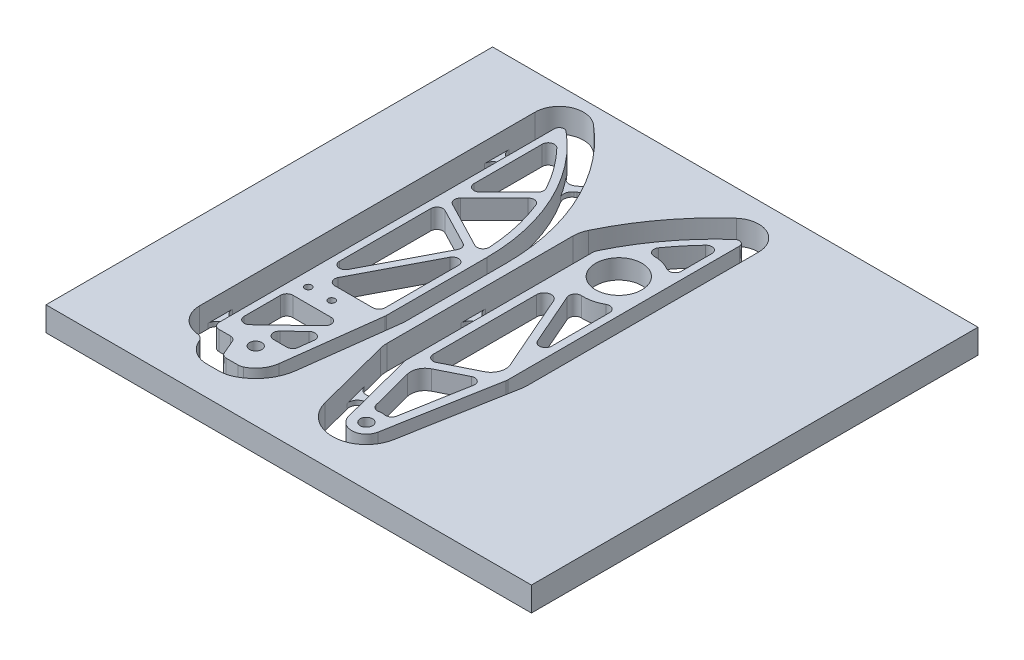
from build123d import *

# Parameters (mm, degrees)
SKETCH1_W                = 317.5
SKETCH1_H                = 292.1
BOSS_EXTRUDE1_DEPTH      = 15.875
CUT_EXTRUDE4_DEPTH       = 432.718282709
SKETCH3_W                = 34.451797714
SKETCH3_H                = 4.7625
SKETCH3_W_2              = 21.406942268
SKETCH3_W_3              = 53.517355672
SKETCH3_W_4              = 30.103512565
EXTRUDE_THIN1_DEPTH      = 3.175
FILLET1_R                = 5.55625
CUT_EXTRUDE5_DEPTH       = 432.61695061
CUT_EXTRUDE5_DEPTH_BACK  = 432.61695061
SKETCH5_R                = 4
SKETCH5_R_2              = 2.2479
SKETCH5_R_3              = 15.113
CUT_EXTRUDE6_DEPTH       = 432.718282854
CUT_EXTRUDE6_DEPTH_BACK  = 3.048
CUT_EXTRUDE7_START       = -15.875
CUT_EXTRUDE7_OUTLINE_R   = 4
CUT_EXTRUDE7_OUTLINE_R_2 = 2.2479
CUT_EXTRUDE7_OUTLINE_R_3 = 15.113
CUT_EXTRUDE7_DEPTH       = 0.127


# Read off the part's stored shape, not the designer's step: Cut-Extrude7
with BuildPart() as part:
    # Sketch1 → Boss-Extrude1 (new body)
    with BuildSketch(Plane(origin=(0, 0, 0), x_dir=(1, 0, 0), z_dir=(0, 1, 0))):
        with Locations((158.75, 146.05)):
            Rectangle(SKETCH1_W, SKETCH1_H)
    extrude(amount=BOSS_EXTRUDE1_DEPTH)

    # Sketch2 → Cut-Extrude4 (cut, through all)
    # profile 1 of 2: a face of its own
    with BuildSketch(Plane(origin=(0, 15.875, 0), x_dir=(1, 0, 0), z_dir=(0, 1, 0))):
        with BuildLine():
            ThreePointArc((93.98, 19.05), (98.356793136, 19.559606751), (102.499418994, 21.061162011))
            ThreePointArc((102.499418994, 21.061162011), (113.711434756, 30.67837066), (119.068868278, 44.444194488))
            Line((119.068868278, 44.444194488), (127, 107.150028804))
            Line((127, 107.150028804), (127, 173.99))
            ThreePointArc((127, 173.99), (113.843281336, 233.17520042), (76.851282051, 281.212469114))
            ThreePointArc((76.851282051, 281.212469114), (59.949409043, 283.408015958), (50.8, 269.028097624))
            Line((50.8, 269.028097624), (50.8, 205.528097624))
            Line((50.8, 205.528097624), (50.8, 49.68875))
            ThreePointArc((50.8, 49.68875), (55.682163841, 37.902163841), (67.46875, 33.02))
            Line((67.46875, 33.02), (69.161686707, 33.02))
            Line((69.161686707, 33.02), (70.780739562, 29.205750502))
            ThreePointArc((70.780739562, 29.205750502), (76.924305214, 21.818915703), (86.124404838, 19.05))
            Line((86.124404838, 19.05), (93.98, 19.05))
        make_face()
        with BuildLine():
            ThreePointArc((96.819806331, 32.420387337), (103.349275969, 38.021099395), (106.469250135, 46.037813842))
            Line((106.469250135, 46.037813842), (114.3, 107.95))
            Line((114.3, 107.95), (114.3, 173.99))
            ThreePointArc((114.3, 173.99), (102.339346669, 227.794727654), (68.71025641, 271.464971922))
            ThreePointArc((68.71025641, 271.464971922), (65.329881809, 271.904081291), (63.5, 269.028097624))
            Line((63.5, 269.028097624), (63.5, 205.528097624))
            Line((63.5, 205.528097624), (63.5, 49.68875))
            ThreePointArc((63.5, 49.68875), (64.662419962, 46.882419962), (67.46875, 45.72))
            Line((67.46875, 45.72), (74.940775013, 45.72))
            ThreePointArc((74.940775013, 45.72), (77.131274924, 45.060734356), (78.594028651, 43.301964166))
            Line((78.594028651, 43.301964166), (82.471151201, 34.168035834))
            ThreePointArc((82.471151201, 34.168035834), (83.933904927, 32.409265644), (86.124404838, 31.75))
            Line((86.124404838, 31.75), (93.98, 31.75))
            ThreePointArc((93.98, 31.75), (95.438931045, 31.919868917), (96.819806331, 32.420387337))
        make_face(mode=Mode.SUBTRACT)
    # profile 2 of 2: a face of its own
    with BuildSketch(Plane(origin=(0, 15.875, 0), x_dir=(1, 0, 0), z_dir=(0, 1, 0))):
        with BuildLine():
            Line((190.149863191, 37.345498076), (202.899882735, 108.322669884))
            ThreePointArc((202.899882735, 108.322669884), (203.124822346, 110.000069896), (203.2, 111.690814391))
            Line((203.2, 111.690814391), (203.2, 199.461781862))
            Line((203.2, 199.461781862), (203.2, 262.961781862))
            ThreePointArc((203.2, 262.961781862), (193.796886398, 277.457654083), (176.726889896, 274.781074871))
            ThreePointArc((176.726889896, 274.781074871), (153.274351746, 249.203062601), (135.236913233, 219.55669572))
            ThreePointArc((135.236913233, 219.55669572), (133.827718195, 215.529881525), (133.35, 211.290441876))
            Line((133.35, 211.290441876), (133.35, 89.712051079))
            ThreePointArc((133.35, 89.712051079), (133.503885239, 87.295577004), (133.963054798, 84.918143318))
            Line((133.963054798, 84.918143318), (146.765230598, 35.682107612))
            ThreePointArc((146.765230598, 35.682107612), (169.126492999, 19.066317358), (190.149863191, 37.345498076))
        make_face()
        with BuildLine():
            ThreePointArc((190.399960912, 110.568099555), (190.474940782, 111.127232892), (190.5, 111.690814391))
            Line((190.5, 111.690814391), (190.5, 199.461781862))
            Line((190.5, 199.461781862), (190.5, 262.961781862))
            ThreePointArc((190.5, 262.961781862), (188.61937728, 265.860956306), (185.205377979, 265.325640464))
            ThreePointArc((185.205377979, 265.325640464), (163.428021126, 241.57462907), (146.678971078, 214.045859824))
            ThreePointArc((146.678971078, 214.045859824), (146.209239398, 212.703588426), (146.05, 211.290441876))
            Line((146.05, 211.290441876), (146.05, 89.712051079))
            ThreePointArc((146.05, 89.712051079), (146.10129508, 88.90655972), (146.254351599, 88.114081825))
            Line((146.254351599, 88.114081825), (159.056527399, 38.87804612))
            ThreePointArc((159.056527399, 38.87804612), (168.639925571, 31.756993154), (177.649941368, 39.590927747))
            Line((177.649941368, 39.590927747), (190.399960912, 110.568099555))
        make_face(mode=Mode.SUBTRACT)
    extrude(amount=-CUT_EXTRUDE4_DEPTH, mode=Mode.SUBTRACT)


with BuildPart() as cut_extrude4_piece_1:
    # of the separate pieces the step leaves, piece 1, a body of its own (cut_extrude4_pieces)
    add(part.part.solids().sort_by_distance((0, 0, 0))[0])



with BuildPart() as cut_extrude4_piece_2:
    # of the separate pieces the step leaves, piece 2, a body of its own (cut_extrude4_pieces)
    add(part.part.solids().sort_by_distance((93.98, 0, -31.75))[0])


with BuildPart() as cut_extrude4_piece_3:
    # of the separate pieces the step leaves, piece 3, a body of its own (cut_extrude4_pieces)
    add(part.part.solids().sort_by_distance((177.649941368, 0, -39.590927747))[0])


with BuildPart() as cut_extrude4_piece_1_1:
    add(cut_extrude4_piece_1.part)

    add(cut_extrude4_piece_2.part)  # Extrude-Thin1 merges Cut-Extrude4 piece 2

    add(cut_extrude4_piece_3.part)  # Extrude-Thin1 merges Cut-Extrude4 piece 3
    # Sketch3 → Extrude-Thin1 (add)
    with BuildSketch(Plane.XZ):
        with Locations((54.391156441, -63.098098709)):
            Rectangle(SKETCH3_W, SKETCH3_H)
        with Locations((57.903232907, -244.053657573)):
            Rectangle(SKETCH3_W_2, SKETCH3_H)
        Polygon((105.819979063, -256.81621981), (87.386290283, -242.705188881), (84.491409086, -246.486864317), (102.925097866, -260.597895246), align=None)
        with Locations((131.824080428, -146.05)):
            Rectangle(SKETCH3_W_3, SKETCH3_H)
        Polygon((98.983231885, -67.268391701), (131.333817554, -63.176639171), (162.721790501, -71.338026292), (212.119539149, -62.464437155), (211.277503022, -57.776966471), (162.908596651, -66.465739014), (131.645376356, -58.336789626), (98.385624628, -62.543534897), align=None)
        with Locations((200.727675855, -220.639814467)):
            Rectangle(SKETCH3_W_4, SKETCH3_H)
        Polygon((167.502952528, -235.534722112), (140.436661592, -255.869577778), (143.297324166, -259.677203796), (170.363615102, -239.342348129), align=None)
    extrude(amount=-EXTRUDE_THIN1_DEPTH)

    # Fillet1
    fillet1_edges = [cut_extrude4_piece_1_1.edges().sort_by_distance(p)[0] for p in [
        (63.5, 1.5875, -241.672407573),
        (63.5, 1.5875, -65.479348709),
        (50.8, 1.5875, -65.479348709),
        (50.8, 1.5875, -241.672407573),
        (89.056230981, 1.5875, -249.98124592),
        (63.5, 1.5875, -246.434907573),
        (50.8, 1.5875, -246.434907573),
        (99.141348066, 1.5875, -257.701426119),
        (91.835126377, 1.5875, -246.110783088),
        (101.930799457, 1.5875, -253.839043925),
        (127, 1.5875, -148.43125),
        (114.3, 1.5875, -148.43125),
        (152.581476625, 1.5875, -63.780518643),
        (181.865880528, 1.5875, -63.0603379),
        (194.365802352, 1.5875, -60.814908229),
        (140.290179824, 1.5875, -60.584580135),
        (120.996383546, 1.5875, -59.683690845),
        (69.161686707, 7.9375, -33.02),
        (50.8, 1.5875, -60.716848709),
        (108.396765402, 1.5875, -61.277310199),
        (114.3, 7.9375, -107.95),
        (114.3, 1.5875, -143.66875),
        (127, 1.5875, -143.66875),
        (127, 7.9375, -107.150028804),
        (121.593990803, 1.5875, -64.408547649),
        (108.99437266, 1.5875, -66.002167002),
        (133.35, 1.5875, -143.66875),
        (146.05, 1.5875, -143.66875),
        (151.382999685, 1.5875, -68.389754943),
        (139.091702884, 1.5875, -65.193816436),
        (203.2, 1.5875, -218.258564467),
        (195.207838478, 1.5875, -65.502378913),
        (182.707916655, 1.5875, -67.747808584),
        (190.5, 1.5875, -218.258564467),
        (154.717432353, 1.5875, -251.097297069),
        (203.2, 1.5875, -223.021064467),
        (190.5, 1.5875, -223.021064467),
        (164.872082547, 1.5875, -243.468126654),
        (146.05, 1.5875, -148.43125),
        (133.35, 1.5875, -148.43125),
        (151.856769779, 1.5875, -247.289671051),
        (162.011419974, 1.5875, -239.660500636),
        (63.5, 1.5875, -60.716848709),
    ]]
    fillet(fillet1_edges, radius=FILLET1_R)

    # Sketch5 → Cut-Extrude5 (cut, two sides: drawn at the far end of the back side and taken through both)
    with BuildSketch(Plane(origin=(0, 12.827, 0), x_dir=(1, 0, 0), z_dir=(0, 1, 0)).offset(-CUT_EXTRUDE5_DEPTH_BACK)):
        with Locations(Location((88.9, 48.26, 0), (0, 0, 270))):
            Circle(SKETCH5_R)
        with Locations(Location((87.9348, 98.87851967, 0), (0, 0, 270))):
            Circle(SKETCH5_R_2)
        with Locations(Location((72.6948, 98.87851967, 0), (0, 0, 270))):
            Circle(SKETCH5_R_2)
        with Locations(Location((168.275, 41.275, 0), (0, 0, 270))):
            Circle(SKETCH5_R)
        with Locations(Location((168.275, 206.375, 0), (0, 0, 270))):
            Circle(SKETCH5_R_3)
        with BuildLine():
            Line((97.228436481, 89.199989199), (72.23125, 89.199989199))
            ThreePointArc((72.23125, 89.199989199), (69.424919962, 88.037569236), (68.2625, 85.231239199))
            Line((68.2625, 85.231239199), (68.2625, 61.350300159))
            ThreePointArc((68.2625, 61.350300159), (70.670714021, 57.701231234), (74.972776042, 58.48062918))
            Line((74.972776042, 58.48062918), (99.969962523, 82.36156822))
            ThreePointArc((99.969962523, 82.36156822), (100.912183437, 86.708055007), (97.228436481, 89.199989199))
        make_face()
        with BuildLine():
            Line((98.541021312, 174.214431092), (74.062980769, 186.949522885))
            ThreePointArc((74.062980769, 186.949522885), (70.171966742, 186.821452175), (68.2625, 183.428764593))
            Line((68.2625, 183.428764593), (68.2625, 123.644583673))
            ThreePointArc((68.2625, 123.644583673), (71.288390761, 119.789458122), (75.752008292, 121.812852904))
            Line((75.752008292, 121.812852904), (100.230048835, 168.86194203))
            ThreePointArc((100.230048835, 168.86194203), (100.494071855, 171.887995615), (98.541021312, 174.214431092))
        make_face()
        with BuildLine():
            Line((73.065401391, 192.837024099), (103.558073809, 176.972723948))
            ThreePointArc((103.558073809, 176.972723948), (107.541624325, 177.158718629), (109.352549698, 180.711719899))
            ThreePointArc((109.352549698, 180.711719899), (106.594068273, 200.653302142), (100.599942838, 219.871688713))
            ThreePointArc((100.599942838, 219.871688713), (97.711058021, 222.271416064), (94.115043227, 221.188353533))
            Line((94.115043227, 221.188353533), (72.090802123, 199.164112429))
            ThreePointArc((72.090802123, 199.164112429), (70.974643958, 195.753578066), (73.065401391, 192.837024099))
        make_face()
        with BuildLine():
            Line((102.047991708, 162.037448693), (77.081999112, 114.050469968))
            ThreePointArc((77.081999112, 114.050469968), (77.210069823, 110.159455941), (80.602757404, 108.249989199))
            Line((80.602757404, 108.249989199), (105.56875, 108.249989199))
            ThreePointArc((105.56875, 108.249989199), (108.375080038, 109.412409161), (109.5375, 112.218739199))
            Line((109.5375, 112.218739199), (109.5375, 160.205717923))
            ThreePointArc((109.5375, 160.205717923), (106.511609239, 164.060843475), (102.047991708, 162.037448693))
        make_face()
        with BuildLine():
            Line((103.593594568, 61.255743952), (104.778005526, 70.620041498))
            ThreePointArc((104.778005526, 70.620041498), (102.627473818, 74.661795188), (98.099098815, 73.987718525))
            Line((98.099098815, 73.987718525), (88.297093474, 64.623420979))
            ThreePointArc((88.297093474, 64.623420979), (87.35487256, 60.276934191), (91.038619515, 57.785))
            Line((91.038619515, 57.785), (99.656213898, 57.785))
            ThreePointArc((99.656213898, 57.785), (102.280572397, 58.776550136), (103.593594568, 61.255743952))
        make_face()
        with BuildLine():
            Line((75.037580038, 208.846082435), (93.96021566, 227.768718056))
            ThreePointArc((93.96021566, 227.768718056), (95.081980308, 230.008436497), (94.638915341, 232.473875211))
            ThreePointArc((94.638915341, 232.473875211), (85.761382702, 246.428681122), (75.081291946, 259.057333275))
            ThreePointArc((75.081291946, 259.057333275), (70.741304936, 259.973863104), (68.2625, 256.29540687))
            Line((68.2625, 256.29540687), (68.2625, 211.652412472))
            ThreePointArc((68.2625, 211.652412472), (70.712475128, 207.985765578), (75.037580038, 208.846082435))
        make_face()
        with BuildLine():
            Line((182.755158287, 120.906210887), (160.731949307, 171.244974269))
            ThreePointArc((160.731949307, 171.244974269), (155.393642429, 173.997680677), (151.60625, 169.336074572))
            Line((151.60625, 169.336074572), (151.60625, 101.649455307))
            ThreePointArc((151.60625, 101.649455307), (153.488504649, 98.273434911), (157.349878957, 98.099697393))
            Line((157.349878957, 98.099697393), (178.288469169, 108.568992499))
            ThreePointArc((178.288469169, 108.568992499), (182.984846449, 113.845860856), (182.755158287, 120.906210887))
        make_face()
        with BuildLine():
            Line((185.7375, 144.944390657), (185.7375, 182.966484851))
            ThreePointArc((185.7375, 182.966484851), (183.754290565, 186.402849969), (179.786706816, 186.404868392))
            ThreePointArc((179.786706816, 186.404868392), (173.578855994, 183.942999157), (166.925812026, 183.364019098))
            ThreePointArc((166.925812026, 183.364019098), (163.437073693, 181.670679586), (163.057514399, 177.811323603))
            Line((163.057514399, 177.811323603), (178.132750577, 143.353640909))
            ThreePointArc((178.132750577, 143.353640909), (182.581339642, 141.059718903), (185.7375, 144.944390657))
        make_face()
        with BuildLine():
            Line((185.7375, 229.783515149), (185.7375, 249.798095612))
            ThreePointArc((185.7375, 249.798095612), (183.235437472, 253.485886878), (178.884055252, 252.523808872))
            ThreePointArc((178.884055252, 252.523808872), (171.670096463, 244.349383856), (165.02832644, 235.70361514))
            ThreePointArc((165.02832644, 235.70361514), (164.727013345, 231.578386148), (168.258777843, 229.425494292))
            ThreePointArc((168.258777843, 229.425494292), (174.225521023, 228.644190596), (179.786706816, 226.345131608))
            ThreePointArc((179.786706816, 226.345131608), (183.754290565, 226.347150031), (185.7375, 229.783515149))
        make_face()
        with BuildLine():
            Line((174.712859121, 54.666472961), (182.372607509, 97.306978369))
            ThreePointArc((182.372607509, 97.306978369), (180.844275194, 101.186189929), (176.691502982, 101.558433055))
            Line((176.691502982, 101.558433055), (159.369011299, 92.897187214))
            ThreePointArc((159.369011299, 92.897187214), (154.956515347, 88.317118121), (154.410248195, 81.980814339))
            Line((154.410248195, 81.980814339), (161.604421612, 54.312659739))
            ThreePointArc((161.604421612, 54.312659739), (163.341524485, 51.946206106), (166.229722079, 51.420902534))
            ThreePointArc((166.229722079, 51.420902534), (168.165391352, 51.624419595), (170.104936779, 51.461944163))
            ThreePointArc((170.104936779, 51.461944163), (173.072577595, 52.109876598), (174.712859121, 54.666472961))
        make_face()
    extrude(amount=CUT_EXTRUDE5_DEPTH + CUT_EXTRUDE5_DEPTH_BACK, mode=Mode.SUBTRACT)

    # Sketch6 → Cut-Extrude6 (cut, two sides: drawn at the far end of the back side and taken through both)
    with BuildSketch(Plane(origin=(0, 15.875, 0), x_dir=(1, 0, 0), z_dir=(0, 1, 0)).offset(-CUT_EXTRUDE6_DEPTH_BACK)):
        with BuildLine():
            Line((106.469250135, 46.037813842), (114.256082938, 107.602778931))
            ThreePointArc((114.256082938, 107.602778931), (114.289009865, 107.950692267), (114.3, 108.299987398))
            Line((114.3, 108.299987398), (114.3, 173.99))
            ThreePointArc((114.3, 173.99), (102.339346669, 227.794727654), (68.71025641, 271.464971922))
            ThreePointArc((68.71025641, 271.464971922), (65.329881809, 271.904081291), (63.5, 269.028097624))
            Line((63.5, 269.028097624), (63.5, 49.68875))
            ThreePointArc((63.5, 49.68875), (64.662419962, 46.882419962), (67.46875, 45.72))
            Line((67.46875, 45.72), (74.940775013, 45.72))
            ThreePointArc((74.940775013, 45.72), (77.131274924, 45.060734356), (78.594028651, 43.301964166))
            Line((78.594028651, 43.301964166), (82.471151201, 34.168035834))
            ThreePointArc((82.471151201, 34.168035834), (83.933904927, 32.409265644), (86.124404838, 31.75))
            Line((86.124404838, 31.75), (93.98, 31.75))
            ThreePointArc((93.98, 31.75), (95.438931045, 31.919868917), (96.819806331, 32.420387337))
            ThreePointArc((96.819806331, 32.420387337), (103.349275969, 38.021099395), (106.469250135, 46.037813842))
        make_face()
        with BuildLine():
            Line((190.5, 111.690814391), (190.5, 262.961781862))
            ThreePointArc((190.5, 262.961781862), (188.61937728, 265.860956306), (185.205377979, 265.325640464))
            ThreePointArc((185.205377979, 265.325640464), (163.428021126, 241.57462907), (146.678971078, 214.045859824))
            ThreePointArc((146.678971078, 214.045859824), (146.209239398, 212.703588426), (146.05, 211.290441876))
            Line((146.05, 211.290441876), (146.05, 89.712051079))
            ThreePointArc((146.05, 89.712051079), (146.10129508, 88.90655972), (146.254351599, 88.114081825))
            Line((146.254351599, 88.114081825), (159.056527399, 38.87804612))
            ThreePointArc((159.056527399, 38.87804612), (168.639925571, 31.756993154), (177.649941368, 39.590927747))
            Line((177.649941368, 39.590927747), (190.399960912, 110.568099555))
            ThreePointArc((190.399960912, 110.568099555), (190.474940782, 111.127232892), (190.5, 111.690814391))
        make_face()
    extrude(amount=CUT_EXTRUDE6_DEPTH + CUT_EXTRUDE6_DEPTH_BACK, mode=Mode.SUBTRACT)

    # Cut-Extrude7 outline → Cut-Extrude7 (cut)
    # profile 1 of 3: a face of its own
    with BuildSketch(Plane(origin=(0, 15.875, 0), x_dir=(1, 0, 0), z_dir=(0, 1, 0)).offset(CUT_EXTRUDE7_START)):
        with BuildLine():
            ThreePointArc((93.98, 31.75), (95.438931045, 31.919868917), (96.819806331, 32.420387337))
            ThreePointArc((96.819806331, 32.420387337), (103.349275969, 38.021099395), (106.469250135, 46.037813842))
            Line((106.469250135, 46.037813842), (107.699556935, 55.764977261))
            ThreePointArc((107.699556935, 55.764977261), (109.807082707, 59.458577629), (113.90909834, 60.580101732))
            Line((113.90909834, 60.580101732), (115.484050608, 60.380899312))
            ThreePointArc((115.484050608, 60.380899312), (119.177650976, 58.27337354), (120.299175078, 54.171357908))
            Line((120.299175078, 54.171357908), (122.29119927, 69.920880587))
            ThreePointArc((122.29119927, 69.920880587), (120.183673498, 66.227280218), (116.081657865, 65.105756116))
            Line((116.081657865, 65.105756116), (114.506705597, 65.304958535))
            ThreePointArc((114.506705597, 65.304958535), (110.813105229, 67.412484308), (109.691581127, 71.51449994))
            Line((109.691581127, 71.51449994), (114.256082938, 107.602778931))
            ThreePointArc((114.256082938, 107.602778931), (114.289009865, 107.950692267), (114.3, 108.299987398))
            Line((114.3, 108.299987398), (114.3, 138.1125))
            ThreePointArc((114.3, 138.1125), (115.927387947, 142.041362053), (119.85625, 143.66875))
            Line((119.85625, 143.66875), (121.44375, 143.66875))
            ThreePointArc((121.44375, 143.66875), (125.372612053, 142.041362053), (127, 138.1125))
            Line((127, 138.1125), (127, 153.9875))
            ThreePointArc((127, 153.9875), (125.372612053, 150.058637947), (121.44375, 148.43125))
            Line((121.44375, 148.43125), (119.85625, 148.43125))
            ThreePointArc((119.85625, 148.43125), (115.927387947, 150.058637947), (114.3, 153.9875))
            Line((114.3, 153.9875), (114.3, 173.99))
            ThreePointArc((114.3, 173.99), (109.283886358, 209.330224518), (94.63178789, 241.878786322))
            ThreePointArc((94.63178789, 241.878786322), (93.857850223, 245.825782493), (95.950192214, 249.260875399))
            Line((95.950192214, 249.260875399), (97.215740856, 250.22965578))
            ThreePointArc((97.215740856, 250.22965578), (101.567063988, 251.28792163), (105.285715956, 248.792812985))
            ThreePointArc((105.285715956, 248.792812985), (100.650736182, 255.645989413), (95.618199732, 262.212772609))
            ThreePointArc((95.618199732, 262.212772609), (96.828372387, 258.055477129), (94.687450912, 254.291957659))
            Line((94.687450912, 254.291957659), (93.42631211, 253.326553021))
            ThreePointArc((93.42631211, 253.326553021), (89.401512348, 252.220107781), (85.742108468, 254.228091206))
            ThreePointArc((85.742108468, 254.228091206), (77.638230015, 263.253677931), (68.71025641, 271.464971922))
            ThreePointArc((68.71025641, 271.464971922), (65.329881808, 271.904081291), (63.5, 269.028097624))
            Line((63.5, 269.028097624), (63.5, 251.991157573))
            ThreePointArc((63.5, 251.991157573), (61.872612053, 248.06229552), (57.94375, 246.434907573))
            Line((57.94375, 246.434907573), (56.35625, 246.434907573))
            ThreePointArc((56.35625, 246.434907573), (52.427387947, 248.06229552), (50.8, 251.991157573))
            Line((50.8, 251.991157573), (50.8, 236.116157573))
            ThreePointArc((50.8, 236.116157573), (52.427387947, 240.045019626), (56.35625, 241.672407573))
            Line((56.35625, 241.672407573), (57.94375, 241.672407573))
            ThreePointArc((57.94375, 241.672407573), (61.872612053, 240.045019626), (63.5, 236.116157573))
            Line((63.5, 236.116157573), (63.5, 71.035598709))
            ThreePointArc((63.5, 71.035598709), (61.872612053, 67.106736656), (57.94375, 65.479348709))
            Line((57.94375, 65.479348709), (56.35625, 65.479348709))
            ThreePointArc((56.35625, 65.479348709), (52.427387947, 67.106736656), (50.8, 71.035598709))
            Line((50.8, 71.035598709), (50.8, 55.160598709))
            ThreePointArc((50.8, 55.160598709), (52.427387947, 59.089460762), (56.35625, 60.716848709))
            Line((56.35625, 60.716848709), (57.94375, 60.716848709))
            ThreePointArc((57.94375, 60.716848709), (61.872612053, 59.089460762), (63.5, 55.160598709))
            Line((63.5, 55.160598709), (63.5, 49.68875))
            ThreePointArc((63.5, 49.68875), (64.662419962, 46.882419962), (67.46875, 45.72))
            Line((67.46875, 45.72), (74.940775013, 45.72))
            ThreePointArc((74.940775013, 45.72), (77.131274924, 45.060734356), (78.594028651, 43.301964166))
            Line((78.594028651, 43.301964166), (82.471151201, 34.168035834))
            ThreePointArc((82.471151201, 34.168035834), (83.933904928, 32.409265644), (86.124404838, 31.75))
            Line((86.124404838, 31.75), (93.98, 31.75))
        make_face()
        with BuildLine():
            ThreePointArc((68.2625, 85.231239199), (69.424919962, 88.037569236), (72.23125, 89.199989199))
            Line((72.23125, 89.199989199), (97.228436481, 89.199989199))
            ThreePointArc((97.228436481, 89.199989199), (100.912183437, 86.708055008), (99.969962523, 82.36156822))
            Line((99.969962523, 82.36156822), (74.972776042, 58.48062918))
            ThreePointArc((74.972776042, 58.48062918), (70.670714021, 57.701231234), (68.2625, 61.350300159))
            Line((68.2625, 61.350300159), (68.2625, 85.231239199))
        make_face(mode=Mode.SUBTRACT)
        with Locations((88.9, 48.26)):
            Circle(CUT_EXTRUDE7_OUTLINE_R, mode=Mode.SUBTRACT)
        with BuildLine():
            ThreePointArc((98.099098815, 73.987718525), (102.627473818, 74.661795188), (104.778005526, 70.620041498))
            Line((104.778005526, 70.620041498), (103.593594568, 61.255743952))
            ThreePointArc((103.593594568, 61.255743952), (102.280572397, 58.776550136), (99.656213898, 57.785))
            Line((99.656213898, 57.785), (91.038619515, 57.785))
            ThreePointArc((91.038619515, 57.785), (87.35487256, 60.276934192), (88.297093474, 64.623420979))
            Line((88.297093474, 64.623420979), (98.099098815, 73.987718525))
        make_face(mode=Mode.SUBTRACT)
        with Locations((72.6948, 98.87851967)):
            Circle(CUT_EXTRUDE7_OUTLINE_R_2, mode=Mode.SUBTRACT)
        with Locations((87.9348, 98.87851967)):
            Circle(CUT_EXTRUDE7_OUTLINE_R_2, mode=Mode.SUBTRACT)
        with BuildLine():
            ThreePointArc((80.602757404, 108.249989199), (77.210069823, 110.159455941), (77.081999112, 114.050469968))
            Line((77.081999112, 114.050469968), (102.047991708, 162.037448693))
            ThreePointArc((102.047991708, 162.037448693), (106.51160924, 164.060843475), (109.5375, 160.205717923))
            Line((109.5375, 160.205717923), (109.5375, 112.218739199))
            ThreePointArc((109.5375, 112.218739199), (108.375080038, 109.412409161), (105.56875, 108.249989199))
            Line((105.56875, 108.249989199), (80.602757404, 108.249989199))
        make_face(mode=Mode.SUBTRACT)
        with BuildLine():
            Line((68.2625, 123.644583673), (68.2625, 183.428764593))
            ThreePointArc((68.2625, 183.428764593), (70.171966742, 186.821452175), (74.062980769, 186.949522885))
            Line((74.062980769, 186.949522885), (98.541021312, 174.214431092))
            ThreePointArc((98.541021312, 174.214431092), (100.494071855, 171.887995615), (100.230048835, 168.86194203))
            Line((100.230048835, 168.86194203), (75.752008292, 121.812852904))
            ThreePointArc((75.752008292, 121.812852904), (71.288390761, 119.789458122), (68.2625, 123.644583673))
        make_face(mode=Mode.SUBTRACT)
        with BuildLine():
            ThreePointArc((109.352549698, 180.711719899), (107.541624325, 177.158718629), (103.558073809, 176.972723948))
            Line((103.558073809, 176.972723948), (73.065401391, 192.837024099))
            ThreePointArc((73.065401391, 192.837024099), (70.974643958, 195.753578066), (72.090802123, 199.164112429))
            Line((72.090802123, 199.164112429), (94.115043227, 221.188353533))
            ThreePointArc((94.115043227, 221.188353533), (97.711058021, 222.271416064), (100.599942838, 219.871688713))
            ThreePointArc((100.599942838, 219.871688713), (106.594068273, 200.653302142), (109.352549698, 180.711719899))
        make_face(mode=Mode.SUBTRACT)
        with BuildLine():
            Line((68.2625, 211.652412472), (68.2625, 256.29540687))
            ThreePointArc((68.2625, 256.29540687), (70.741304936, 259.973863104), (75.081291946, 259.057333275))
            ThreePointArc((75.081291946, 259.057333275), (85.761382702, 246.428681122), (94.638915341, 232.473875211))
            ThreePointArc((94.638915341, 232.473875211), (95.081980308, 230.008436497), (93.96021566, 227.768718056))
            Line((93.96021566, 227.768718056), (75.037580038, 208.846082435))
            ThreePointArc((75.037580038, 208.846082435), (70.712475128, 207.985765578), (68.2625, 211.652412472))
        make_face(mode=Mode.SUBTRACT)
    # profile 2 of 3: a face of its own
    with BuildSketch(Plane(origin=(0, 15.875, 0), x_dir=(1, 0, 0), z_dir=(0, 1, 0)).offset(CUT_EXTRUDE7_START)):
        with BuildLine():
            ThreePointArc((127, 107.500016202), (126.989009865, 107.150721071), (126.956082938, 106.802807735))
            Line((126.956082938, 106.802807735), (127, 107.150028804))
            Line((127, 107.150028804), (127, 107.500016202))
        make_face()
    # profile 3 of 3: a face of its own
    with BuildSketch(Plane(origin=(0, 15.875, 0), x_dir=(1, 0, 0), z_dir=(0, 1, 0)).offset(CUT_EXTRUDE7_START)):
        with BuildLine():
            Line((183.690292136, 73.216524382), (190.399960912, 110.568099555))
            ThreePointArc((190.399960912, 110.568099555), (190.474940782, 111.127232892), (190.5, 111.690814391))
            Line((190.5, 111.690814391), (190.5, 212.702314467))
            ThreePointArc((190.5, 212.702314467), (192.127387947, 216.63117652), (196.05625, 218.258564467))
            Line((196.05625, 218.258564467), (197.64375, 218.258564467))
            ThreePointArc((197.64375, 218.258564467), (201.572612053, 216.63117652), (203.2, 212.702314467))
            Line((203.2, 212.702314467), (203.2, 228.577314467))
            ThreePointArc((203.2, 228.577314467), (201.572612053, 224.648452414), (197.64375, 223.021064467))
            Line((197.64375, 223.021064467), (196.05625, 223.021064467))
            ThreePointArc((196.05625, 223.021064467), (192.127387947, 224.648452414), (190.5, 228.577314467))
            Line((190.5, 228.577314467), (190.5, 262.961781862))
            ThreePointArc((190.5, 262.961781862), (188.61937728, 265.860956306), (185.205377979, 265.325640464))
            ThreePointArc((185.205377979, 265.325640464), (176.364320371, 256.78327953), (168.183417028, 247.60673059))
            ThreePointArc((168.183417028, 247.60673059), (164.554251431, 245.629432356), (160.563784367, 246.704943323))
            Line((160.563784367, 246.704943323), (159.293213297, 247.659521081))
            ThreePointArc((159.293213297, 247.659521081), (157.113051893, 251.447540116), (158.346941028, 255.640356539))
            ThreePointArc((158.346941028, 255.640356539), (153.274351746, 249.203062601), (148.503800989, 242.538847662))
            ThreePointArc((148.503800989, 242.538847662), (152.187327428, 244.891255989), (156.432550723, 243.851895063))
            Line((156.432550723, 243.851895063), (157.703121793, 242.897317305))
            ThreePointArc((157.703121793, 242.897317305), (159.847078494, 239.364046738), (158.958334619, 235.327874596))
            ThreePointArc((158.958334619, 235.327874596), (152.422200333, 224.915613624), (146.678971078, 214.045859824))
            ThreePointArc((146.678971078, 214.045859824), (146.209239398, 212.703588426), (146.05, 211.290441876))
            Line((146.05, 211.290441876), (146.05, 153.9875))
            ThreePointArc((146.05, 153.9875), (144.422612053, 150.058637947), (140.49375, 148.43125))
            Line((140.49375, 148.43125), (138.90625, 148.43125))
            ThreePointArc((138.90625, 148.43125), (134.977387947, 150.058637947), (133.35, 153.9875))
            Line((133.35, 153.9875), (133.35, 138.1125))
            ThreePointArc((133.35, 138.1125), (134.977387947, 142.041362053), (138.90625, 143.66875))
            Line((138.90625, 143.66875), (140.49375, 143.66875))
            ThreePointArc((140.49375, 143.66875), (144.422612053, 142.041362053), (146.05, 138.1125))
            Line((146.05, 138.1125), (146.05, 89.712051079))
            ThreePointArc((146.05, 89.712051079), (146.10129508, 88.906559721), (146.254351599, 88.114081825))
            Line((146.254351599, 88.114081825), (149.984776588, 73.767197294))
            ThreePointArc((149.984776588, 73.767197294), (149.398453223, 69.555241279), (146.005557335, 66.991531846))
            Line((146.005557335, 66.991531846), (144.469145234, 66.592039533))
            ThreePointArc((144.469145234, 66.592039533), (140.257189219, 67.178362898), (137.693479787, 70.571258786))
            Line((137.693479787, 70.571258786), (141.688402921, 55.207137785))
            ThreePointArc((141.688402921, 55.207137785), (142.274726287, 59.4190938), (145.667622175, 61.982803232))
            Line((145.667622175, 61.982803232), (147.204034275, 62.382295546))
            ThreePointArc((147.204034275, 62.382295546), (151.41599029, 61.79597218), (153.979699722, 58.403076292))
            Line((153.979699722, 58.403076292), (159.056527399, 38.87804612))
            ThreePointArc((159.056527399, 38.87804612), (168.639925571, 31.756993154), (177.649941368, 39.590927747))
            Line((177.649941368, 39.590927747), (180.883505047, 57.591622102))
            ThreePointArc((180.883505047, 57.591622102), (183.179899184, 61.17085701), (187.334596326, 62.077962419))
            Line((187.334596326, 62.077962419), (188.897086554, 61.79728371))
            ThreePointArc((188.897086554, 61.79728371), (192.476321462, 59.500889573), (193.383426871, 55.346192431))
            Line((193.383426871, 55.346192431), (196.19021396, 70.97109471))
            ThreePointArc((196.19021396, 70.97109471), (193.893819822, 67.391859802), (189.739122681, 66.484754394))
            Line((189.739122681, 66.484754394), (188.176632453, 66.765433103))
            ThreePointArc((188.176632453, 66.765433103), (184.597397544, 69.06182724), (183.690292136, 73.216524382))
        make_face()
        with Locations((168.275, 41.275)):
            Circle(CUT_EXTRUDE7_OUTLINE_R, mode=Mode.SUBTRACT)
        with BuildLine():
            ThreePointArc((176.691502982, 101.558433055), (180.844275194, 101.186189929), (182.372607509, 97.306978369))
            Line((182.372607509, 97.306978369), (174.712859121, 54.666472961))
            ThreePointArc((174.712859121, 54.666472961), (173.072577595, 52.109876598), (170.104936779, 51.461944163))
            ThreePointArc((170.104936779, 51.461944163), (168.165391352, 51.624419595), (166.229722079, 51.420902534))
            ThreePointArc((166.229722079, 51.420902534), (163.341524485, 51.946206106), (161.604421612, 54.312659739))
            Line((161.604421612, 54.312659739), (154.410248195, 81.980814339))
            ThreePointArc((154.410248195, 81.980814339), (154.956515347, 88.317118121), (159.369011299, 92.897187214))
            Line((159.369011299, 92.897187214), (176.691502982, 101.558433055))
        make_face(mode=Mode.SUBTRACT)
        with BuildLine():
            ThreePointArc((151.60625, 169.336074572), (155.393642429, 173.997680677), (160.731949307, 171.244974269))
            Line((160.731949307, 171.244974269), (182.755158287, 120.906210887))
            ThreePointArc((182.755158287, 120.906210887), (182.984846449, 113.845860856), (178.288469169, 108.568992499))
            Line((178.288469169, 108.568992499), (157.349878957, 98.099697393))
            ThreePointArc((157.349878957, 98.099697393), (153.488504649, 98.273434911), (151.60625, 101.649455307))
            Line((151.60625, 101.649455307), (151.60625, 169.336074572))
        make_face(mode=Mode.SUBTRACT)
        with BuildLine():
            ThreePointArc((163.057514399, 177.811323603), (163.437073693, 181.670679586), (166.925812026, 183.364019098))
            ThreePointArc((166.925812026, 183.364019098), (173.578855994, 183.942999157), (179.786706816, 186.404868392))
            ThreePointArc((179.786706816, 186.404868392), (183.754290565, 186.402849969), (185.7375, 182.966484851))
            Line((185.7375, 182.966484851), (185.7375, 144.944390657))
            ThreePointArc((185.7375, 144.944390657), (182.581339642, 141.059718903), (178.132750577, 143.353640909))
            Line((178.132750577, 143.353640909), (163.057514399, 177.811323603))
        make_face(mode=Mode.SUBTRACT)
        with Locations((168.275, 206.375)):
            Circle(CUT_EXTRUDE7_OUTLINE_R_3, mode=Mode.SUBTRACT)
        with BuildLine():
            ThreePointArc((185.7375, 229.783515149), (183.754290565, 226.347150031), (179.786706816, 226.345131608))
            ThreePointArc((179.786706816, 226.345131608), (174.225521024, 228.644190596), (168.258777843, 229.425494292))
            ThreePointArc((168.258777843, 229.425494292), (164.727013345, 231.578386148), (165.02832644, 235.70361514))
            ThreePointArc((165.02832644, 235.70361514), (171.670096463, 244.349383856), (178.884055252, 252.523808872))
            ThreePointArc((178.884055252, 252.523808872), (183.235437472, 253.485886878), (185.7375, 249.798095612))
            Line((185.7375, 249.798095612), (185.7375, 229.783515149))
        make_face(mode=Mode.SUBTRACT)
    extrude(amount=CUT_EXTRUDE7_DEPTH, mode=Mode.SUBTRACT)


solid = cut_extrude4_piece_1_1.part
